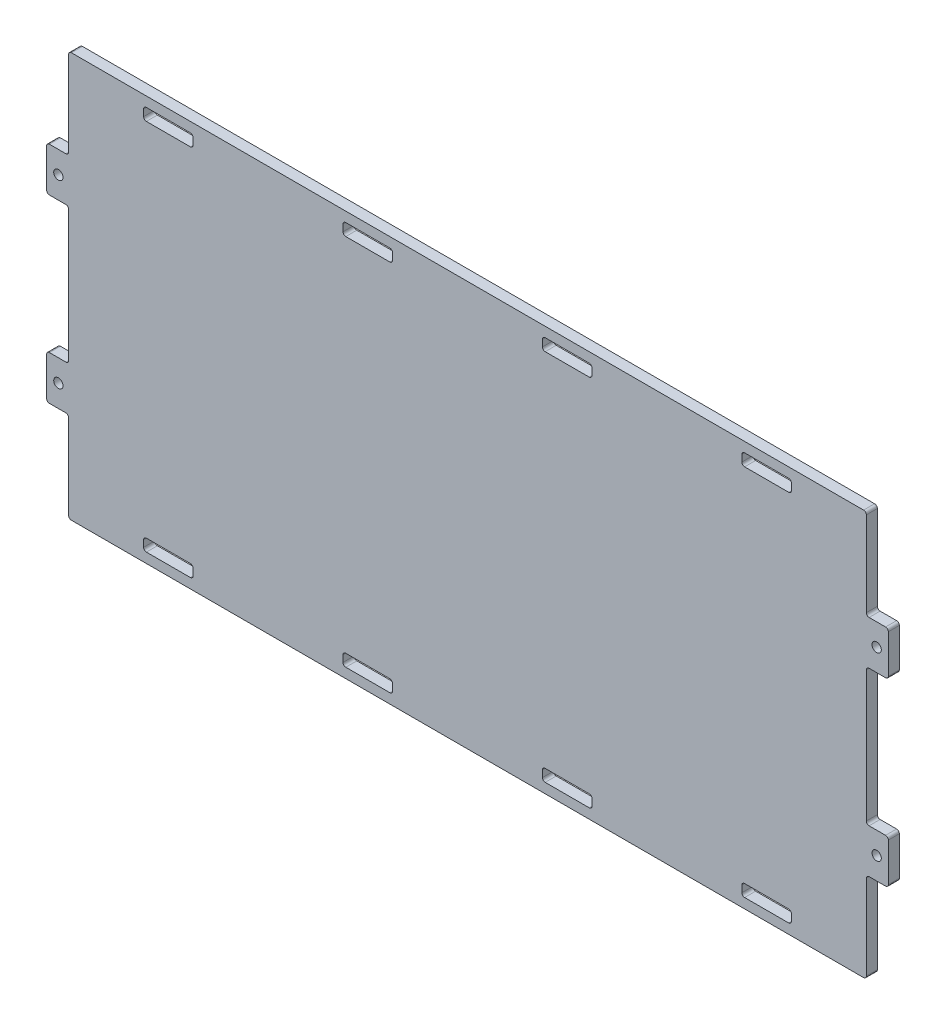
from build123d import *

# Parameters (mm, degrees)
SKETCH1_W            = 920.75
SKETCH1_H            = 416.56
BOSS_EXTRUDE1_DEPTH  = 6.35
SKETCH2_W            = 920.75
SKETCH2_H            = 25.4
BOSS_EXTRUDE2_DEPTH  = 6.35
SKETCH3_W            = 57.15
SKETCH3_H            = 13.97
TAB_HOLES_DEPTH      = 517.442419854
SKETCH4_W            = 25.4
SKETCH4_H            = 50.8
SKETCH4_R            = 5.3578125
TABS_DEPTH           = 6.35
FILLET1_R            = 3.175
FILLET2_R            = 3.175
FILLET2_OF_MIRROR2_R = 3.175
MIRROR4_START        = -6.35
MIRROR4_DEPTH        = 12.7
MIRROR4_2_OUTLINE_R  = 5.3578125
MIRROR4_2_DEPTH      = 12.7
FILLET3_R            = 3.175


# Read off the part's stored shape, not the designer's step: Mirror4
with BuildPart() as part:
    # Sketch1 → Boss-Extrude1 (new, symmetric)
    with BuildSketch(Plane.XY):
        Rectangle(SKETCH1_W, SKETCH1_H)
    extrude(amount=BOSS_EXTRUDE1_DEPTH, both=True)

    # Sketch2 → Boss-Extrude2 (add, symmetric)
    with BuildSketch(Plane.XY):
        with Locations((0, 220.98)):
            Rectangle(SKETCH2_W, SKETCH2_H)
        with Locations((0, -220.98)):
            Rectangle(SKETCH2_W, SKETCH2_H)
    extrude(amount=BOSS_EXTRUDE2_DEPTH, both=True)

    # Sketch3 → Tab Holes (cut, through all)
    with BuildSketch(Plane.XY.offset(6.35)):
        with Locations((-345.28125, 215.265)):
            Rectangle(SKETCH3_W, SKETCH3_H)
        with Locations((-115.09375, 215.265)):
            Rectangle(SKETCH3_W, SKETCH3_H)
    tab_holes = extrude(amount=-TAB_HOLES_DEPTH, mode=Mode.SUBTRACT)

    # Sketch4 → Tabs (add, symmetric)
    # profile 1 of 2: a face of its own
    with BuildSketch(Plane.XY):
        with Locations((-473.075, 104.14)):
            Rectangle(SKETCH4_W, SKETCH4_H)
        with Locations((-472.28125, 104.14)):
            Circle(SKETCH4_R, mode=Mode.SUBTRACT)
    # profile 2 of 2: a face of its own
    with BuildSketch(Plane.XY):
        with Locations((-473.075, -104.14)):
            Rectangle(SKETCH4_W, SKETCH4_H)
        with Locations((-472.28125, -104.14)):
            Circle(SKETCH4_R, mode=Mode.SUBTRACT)
    extrude(amount=TABS_DEPTH, both=True)

    # Fillet1
    fillet1_edges = [part.edges().sort_by_distance(p)[0] for p in [
        (-460.375, 233.68, 0),
        (-460.375, -233.68, 0),
        (-460.375, 78.74, 0),
        (-460.375, 129.54, 0),
        (-485.775, 129.54, 0),
        (-485.775, 78.74, 0),
        (-460.375, -129.54, 0),
        (-460.375, -78.74, 0),
        (-485.775, -78.74, 0),
        (-485.775, -129.54, 0),
    ]]
    fillet(fillet1_edges, radius=FILLET1_R)

    # Fillet2
    fillet2_edges = [part.edges().sort_by_distance(p)[0] for p in [
        (-373.85625, 208.28, 0),
        (-373.85625, 222.25, 0),
        (-316.70625, 222.25, 0),
        (-316.70625, 208.28, 0),
        (-143.66875, 208.28, 0),
        (-143.66875, 222.25, 0),
        (-86.51875, 222.25, 0),
        (-86.51875, 208.28, 0),
    ]]
    fillet(fillet2_edges, radius=FILLET2_R)

    # Mirror2: Tab Holes across plane
    add(tab_holes.mirror(Plane.ZX), mode=Mode.SUBTRACT)

    # Fillet2 of Mirror2
    fillet2_of_mirror2_edges = [part.edges().sort_by_distance(p)[0] for p in [
        (-373.85625, -208.28, 0),
        (-373.85625, -222.25, 0),
        (-316.70625, -222.25, 0),
        (-316.70625, -208.28, 0),
        (-143.66875, -208.28, 0),
        (-143.66875, -222.25, 0),
        (-86.51875, -222.25, 0),
        (-86.51875, -208.28, 0),
    ]]
    fillet(fillet2_of_mirror2_edges, radius=FILLET2_OF_MIRROR2_R)

    # Mirror4 outline → Mirror4 (cut)
    with BuildSketch(Plane.XY.offset(MIRROR4_START)):
        with BuildLine():
            Line((140.49375, 222.25), (89.69375, 222.25))
            ThreePointArc((89.69375, 222.25), (87.44868597, 221.32006403), (86.51875, 219.075))
            Line((86.51875, 219.075), (86.51875, 211.455))
            ThreePointArc((86.51875, 211.455), (87.44868597, 209.20993597), (89.69375, 208.28))
            Line((89.69375, 208.28), (140.49375, 208.28))
            ThreePointArc((140.49375, 208.28), (142.73881403, 209.20993597), (143.66875, 211.455))
            Line((143.66875, 211.455), (143.66875, 219.075))
            ThreePointArc((143.66875, 219.075), (142.73881403, 221.32006403), (140.49375, 222.25))
        make_face()
        with BuildLine():
            Line((370.68125, 222.25), (319.88125, 222.25))
            ThreePointArc((319.88125, 222.25), (317.63618597, 221.32006403), (316.70625, 219.075))
            Line((316.70625, 219.075), (316.70625, 211.455))
            ThreePointArc((316.70625, 211.455), (317.63618597, 209.20993597), (319.88125, 208.28))
            Line((319.88125, 208.28), (370.68125, 208.28))
            ThreePointArc((370.68125, 208.28), (372.92631403, 209.20993597), (373.85625, 211.455))
            Line((373.85625, 211.455), (373.85625, 219.075))
            ThreePointArc((373.85625, 219.075), (372.92631403, 221.32006403), (370.68125, 222.25))
        make_face()
        with BuildLine():
            ThreePointArc((143.66875, -211.455), (142.73881403, -209.20993597), (140.49375, -208.28))
            Line((140.49375, -208.28), (89.69375, -208.28))
            ThreePointArc((89.69375, -208.28), (87.44868597, -209.20993597), (86.51875, -211.455))
            Line((86.51875, -211.455), (86.51875, -219.075))
            ThreePointArc((86.51875, -219.075), (87.44868597, -221.32006403), (89.69375, -222.25))
            Line((89.69375, -222.25), (140.49375, -222.25))
            ThreePointArc((140.49375, -222.25), (142.73881403, -221.32006403), (143.66875, -219.075))
            Line((143.66875, -219.075), (143.66875, -211.455))
        make_face()
        with BuildLine():
            ThreePointArc((373.85625, -211.455), (372.92631403, -209.20993597), (370.68125, -208.28))
            Line((370.68125, -208.28), (319.88125, -208.28))
            ThreePointArc((319.88125, -208.28), (317.63618597, -209.20993597), (316.70625, -211.455))
            Line((316.70625, -211.455), (316.70625, -219.075))
            ThreePointArc((316.70625, -219.075), (317.63618597, -221.32006403), (319.88125, -222.25))
            Line((319.88125, -222.25), (370.68125, -222.25))
            ThreePointArc((370.68125, -222.25), (372.92631403, -221.32006403), (373.85625, -219.075))
            Line((373.85625, -219.075), (373.85625, -211.455))
        make_face()
    extrude(amount=MIRROR4_DEPTH, mode=Mode.SUBTRACT)

    # Mirror4 2 outline → Mirror4 2 (add)
    # profile 1 of 2: a face of its own
    with BuildSketch(Plane.XY.offset(MIRROR4_START)):
        with BuildLine():
            ThreePointArc((485.775, 126.365), (484.84506403, 128.61006403), (482.6, 129.54))
            Line((482.6, 129.54), (460.375, 129.54))
            Line((460.375, 129.54), (460.375, 78.74))
            Line((460.375, 78.74), (482.6, 78.74))
            ThreePointArc((482.6, 78.74), (484.84506403, 79.66993597), (485.775, 81.915))
            Line((485.775, 81.915), (485.775, 126.365))
        make_face()
        with Locations((472.28125, 104.14)):
            Circle(MIRROR4_2_OUTLINE_R, mode=Mode.SUBTRACT)
    # profile 2 of 2: a face of its own
    with BuildSketch(Plane.XY.offset(MIRROR4_START)):
        with BuildLine():
            Line((482.6, -78.74), (460.375, -78.74))
            Line((460.375, -78.74), (460.375, -129.54))
            Line((460.375, -129.54), (482.6, -129.54))
            ThreePointArc((482.6, -129.54), (484.84506403, -128.61006403), (485.775, -126.365))
            Line((485.775, -126.365), (485.775, -81.915))
            ThreePointArc((485.775, -81.915), (484.84506403, -79.66993597), (482.6, -78.74))
        make_face()
        with Locations((472.28125, -104.14)):
            Circle(MIRROR4_2_OUTLINE_R, mode=Mode.SUBTRACT)
    extrude(amount=MIRROR4_2_DEPTH)

    # Fillet3
    fillet3_edges = [part.edges().sort_by_distance(p)[0] for p in [
        (460.375, 233.68, 0),
        (460.375, -233.68, 0),
        (460.375, 129.54, 0),
        (460.375, 78.74, 0),
        (460.375, -78.74, 0),
        (460.375, -129.54, 0),
    ]]
    fillet(fillet3_edges, radius=FILLET3_R)


solid = part.part
